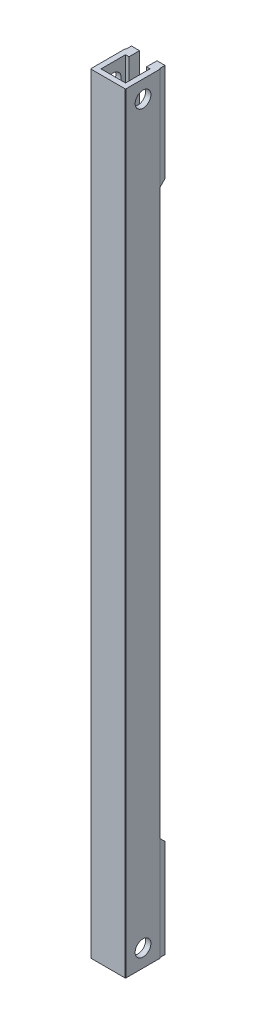
from build123d import *

# Parameters (mm, degrees)
SKETCH1_W               = 10
SKETCH1_H               = 10
SKETCH1_W_2             = 7
SKETCH1_H_2             = 7
EXTRUDE_THIN1_DEPTH     = 220
CUT_EXTRUDE1_DEPTH      = 221.113607031
CUT_EXTRUDE1_DEPTH_BACK = 221.113607031
SKETCH2_R               = 2.25
FILLET1_R               = 0.2
CUT_EXTRUDE2_REACH      = 222.284
SKETCH5_W               = 5
SKETCH5_H               = 25
BOSS_EXTRUDE3_DEPTH     = 1.5
CHAMFER1_SIZE           = 2


with BuildPart() as part:
    # Sketch1 → Extrude-Thin1 (new body)
    with BuildSketch(Plane(origin=(0, 0, 0), x_dir=(1, 0, 0), z_dir=(0, 1, 0))):
        Rectangle(SKETCH1_W, SKETCH1_H)
        Rectangle(SKETCH1_W_2, SKETCH1_H_2, mode=Mode.SUBTRACT)
    extrude(amount=EXTRUDE_THIN1_DEPTH)

    # Sketch2 → Cut-Extrude1 (cut, two sides: drawn at the far end of the back side and taken through both)
    with BuildSketch(Plane(origin=(0, 0, 0), x_dir=(0, 0, -1), z_dir=(1, 0, 0)).offset(-CUT_EXTRUDE1_DEPTH_BACK)):
        with Locations((0, 215)):
            Circle(SKETCH2_R)
        with Locations(Location((0, 5, 0), (0, 0, 180))):
            Circle(SKETCH2_R)
    extrude(amount=CUT_EXTRUDE1_DEPTH + CUT_EXTRUDE1_DEPTH_BACK, mode=Mode.SUBTRACT)

    # Fillet1
    fillet1_edges = [part.edges().sort_by_distance(p)[0] for p in [
        (-5, 110, -5),
        (5, 110, -5),
        (5, 110, 5),
        (-5, 110, 5),
    ]]
    fillet(fillet1_edges, radius=FILLET1_R)

    # Sketch5 → Cut-Extrude2 (cut, up to next)
    with BuildSketch(Plane(origin=(0, 0, -5), x_dir=(-1, 0, 0), z_dir=(0, 0, -1)), mode=Mode.PRIVATE) as cut_extrude2_sk1:
        with Locations((0, 207.5)):
            Rectangle(SKETCH5_W, SKETCH5_H)
    cut_extrude2_tool1 = extrude(cut_extrude2_sk1.sketch, amount=-CUT_EXTRUDE2_REACH, mode=Mode.PRIVATE) & part.part
    # Sketch5 → Cut-Extrude2 (cut, up to next)
    with BuildSketch(Plane(origin=(0, 0, -5), x_dir=(-1, 0, 0), z_dir=(0, 0, -1)), mode=Mode.PRIVATE) as cut_extrude2_sk2:
        with Locations((0, 12.5)):
            Rectangle(SKETCH5_W, SKETCH5_H)
    cut_extrude2_tool2 = extrude(cut_extrude2_sk2.sketch, amount=-CUT_EXTRUDE2_REACH, mode=Mode.PRIVATE) & part.part
    add(cut_extrude2_tool1.solids().sort_by_distance((0, 207.5, -5))[0], mode=Mode.SUBTRACT)
    add(cut_extrude2_tool2.solids().sort_by_distance((0, 12.5, -5))[0], mode=Mode.SUBTRACT)

    # Sketch5<3> → Boss-Extrude3 (add)
    with BuildSketch(Plane(origin=(0, 0, -5), x_dir=(-1, 0, 0), z_dir=(0, 0, -1))):
        Polygon((4.8, 0), (4.8, 27.5), (-4.8, 27.5), (-4.8, 0), (-2.5, 0), (-2.5, 25), (2.5, 25), (2.5, 0), align=None)
        Polygon((-4.8, 192.5), (4.8, 192.5), (4.8, 220), (2.5, 220), (2.5, 195), (-2.5, 195), (-2.5, 220), (-4.8, 220), align=None)
    extrude(amount=BOSS_EXTRUDE3_DEPTH)

    # Chamfer1
    # the kernel refuses this chamfer: 2 mm, written as the material it adds along each edge
    with BuildSketch(Plane(origin=(-4.8, 27.5, -5), x_dir=(0, 0.9996219169112968, 0.02749587661058694), z_dir=(1, 0, 0))) as chamfer1_piece_1_section:
        Polygon((CHAMFER1_SIZE * 0.999621916911, -CHAMFER1_SIZE * 0.0274958766106), (-CHAMFER1_SIZE * 0.0274958766106, -CHAMFER1_SIZE * 0.999621916911), (0, 0), align=None)
    chamfer1_piece_1 = extrude(amount=9.6, mode=Mode.PRIVATE)
    chamfer1_piece_1 = split(chamfer1_piece_1, bisect_by=Plane(origin=(0, 28.20391822, -6.5), z_dir=(0, 0, 1)), keep=Keep.TOP, mode=Mode.PRIVATE)
    add(chamfer1_piece_1)
    with BuildSketch(Plane(origin=(4.8, 192.5, -5), x_dir=(0, -0.9996219169112968, 0.027495876610586605), z_dir=(-1, 0, 0))) as chamfer1_piece_2_section:
        Polygon((CHAMFER1_SIZE * 0.999621916911, -CHAMFER1_SIZE * 0.0274958766106), (-CHAMFER1_SIZE * 0.0274958766106, -CHAMFER1_SIZE * 0.999621916911), (0, 0), align=None)
    chamfer1_piece_2 = extrude(amount=9.6, mode=Mode.PRIVATE)
    chamfer1_piece_2 = split(chamfer1_piece_2, bisect_by=Plane(origin=(0, 191.79608178, -6.5), z_dir=(0, 0, 1)), keep=Keep.TOP, mode=Mode.PRIVATE)
    add(chamfer1_piece_2)


solid = part.part
